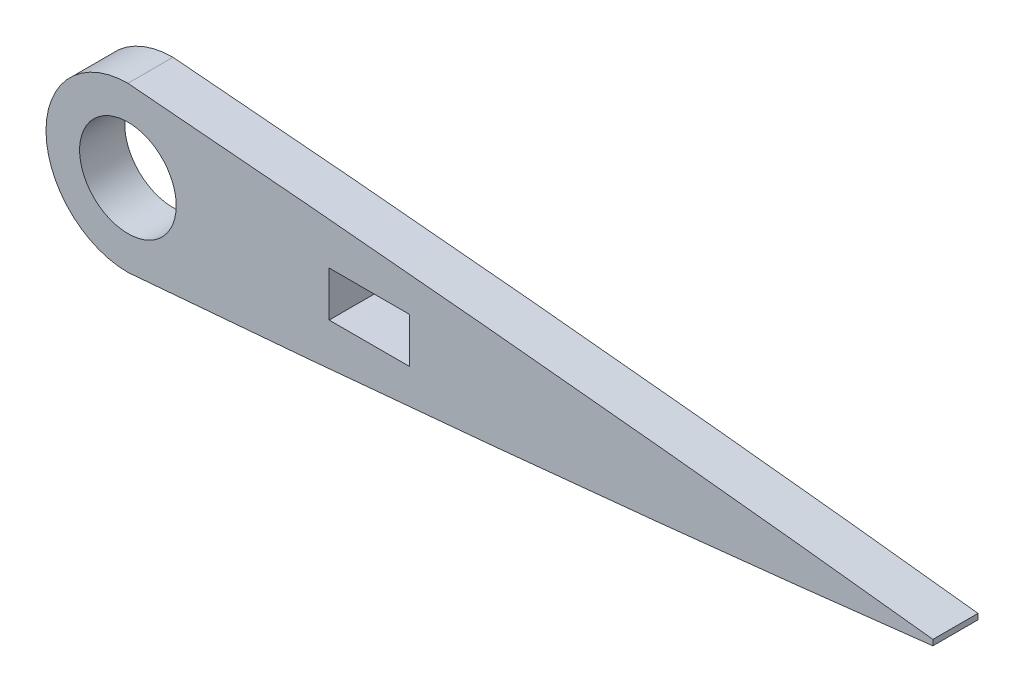
from build123d import *

# Parameters (mm, degrees)
SKETCH_1_R      = 3
SKETCH_1_W      = 5
SKETCH_1_H      = 2.8
EXTRUDE_1_DEPTH = 1.4


with BuildPart() as part:
    # Эскиз1 → Бобышка-Вытянуть1 (new, symmetric)
    with BuildSketch(Plane.XY):
        with BuildLine():
            Line((200, -0.17472), (200, 0.17472))
            add(Edge.make_bspline(
                [(200, 0.17472), (199.600682765, 0.221288408), (198.485364747, 0.351356884), (196.461970705, 0.583806064), (193.785612886, 0.886133118), (190.657944971, 1.231938396), (187.176422045, 1.607822673), (183.406732336, 2.004490231), (179.398353357, 2.414941802), (173.685417785, 2.983325928), (167.76840734, 3.545499789), (161.683149627, 4.096290968), (156.969182151, 4.508276909), (153.064759225, 4.837015276), (150.733840137, 5.027649351), (150, 5.087100899)],
                knots=[0, 0, 0, 0, 0.007144724, 0.019955661, 0.036196061, 0.055011184, 0.075878938, 0.098428866, 0.122375554, 0.147487886, 0.200459747, 0.22800517, 0.256076454, 0.284555151, 0.297639613, 0.297639613, 0.297639613, 0.297639613], degree=3))
            ThreePointArc((150, 5.087100899), (144.91290042, 0), (150, -5.087100899))
            add(Edge.make_bspline(
                [(150, -5.087100899), (150.733840137, -5.027649351), (153.064759225, -4.837015276), (156.969182151, -4.508276909), (161.683149627, -4.096290968), (167.76840734, -3.545499789), (173.685417785, -2.983325928), (179.398353357, -2.414941802), (183.406732336, -2.004490231), (187.176422045, -1.607822673), (190.657944971, -1.231938396), (193.785612886, -0.886133118), (196.461970705, -0.583806064), (198.485364747, -0.351356884), (199.600682765, -0.221288408), (200, -0.17472)],
                knots=[0.702360387, 0.702360387, 0.702360387, 0.702360387, 0.715444849, 0.743923546, 0.77199483, 0.799540253, 0.852512114, 0.877624446, 0.901571134, 0.924121062, 0.944988816, 0.963803939, 0.980044339, 0.992855276, 1, 1, 1, 1], degree=3))
        make_face()
        with Locations((150.000001319, 0)):
            Circle(SKETCH_1_R, mode=Mode.SUBTRACT)
        with Locations((165.000001319, 0)):
            Rectangle(SKETCH_1_W, SKETCH_1_H, mode=Mode.SUBTRACT)
    extrude(amount=EXTRUDE_1_DEPTH, both=True)


solid = part.part
